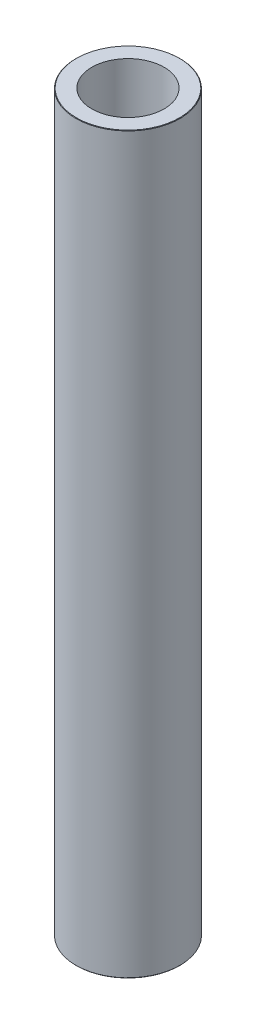
from build123d import *
from OCP.BRepFilletAPI import BRepFilletAPI_MakeChamfer

# Parameters (mm, degrees)
SKETCH1_R           = 42.5
BOSS_EXTRUDE1_DEPTH = 600
SKETCH2_R           = 29.540810868
CUT_EXTRUDE1_DEPTH  = 604.002902149
CHAMFER1_SIZE       = 0.322230421
CHAMFER1_SIZE2      = 0.388000761


with BuildPart() as part:
    # Sketch1 → Boss-Extrude1 (new body)
    with BuildSketch(Plane(origin=(0, 0, 0), x_dir=(1, 0, 0), z_dir=(0, 1, 0))):
        Circle(SKETCH1_R)
    extrude(amount=BOSS_EXTRUDE1_DEPTH)

    # Sketch2 → Cut-Extrude1 (cut, through all)
    with BuildSketch(Plane(origin=(0, 0, 0), x_dir=(1, 0, 0), z_dir=(0, 1, 0))):
        Circle(SKETCH2_R)
    extrude(amount=CUT_EXTRUDE1_DEPTH, mode=Mode.SUBTRACT)

    # Chamfer1: one chamfer whose edges measure the first distance from different faces: ONE call of the kernel's chamfer builder (chamfer() names one face for all edges)
    chamfer1_edges_1 = [part.edges().sort_by_distance(p)[0] for p in [
        (-42.5, 600, 0),
    ]]
    chamfer1_side_1 = [part.faces().sort_by_distance(p)[0] for p in [
        (-42.5, 300, 0),
    ]]
    chamfer1_edges_2 = [part.edges().sort_by_distance(p)[0] for p in [
        (-42.5, 0, 0),
    ]]
    chamfer1_side_2 = [part.faces().sort_by_distance(p)[0] for p in [
        (-41.297918472, 0, 0),
    ]]
    chamfer1 = BRepFilletAPI_MakeChamfer(part.part.solid().wrapped)
    for e in chamfer1_edges_1:
        chamfer1.Add(CHAMFER1_SIZE, CHAMFER1_SIZE2, e.wrapped, chamfer1_side_1[0].wrapped)  # the first distance lies on this face
    for e in chamfer1_edges_2:
        chamfer1.Add(CHAMFER1_SIZE, CHAMFER1_SIZE2, e.wrapped, chamfer1_side_2[0].wrapped)  # the first distance lies on this face
    add(Compound.cast(chamfer1.Shape()), mode=Mode.REPLACE)


solid = part.part
